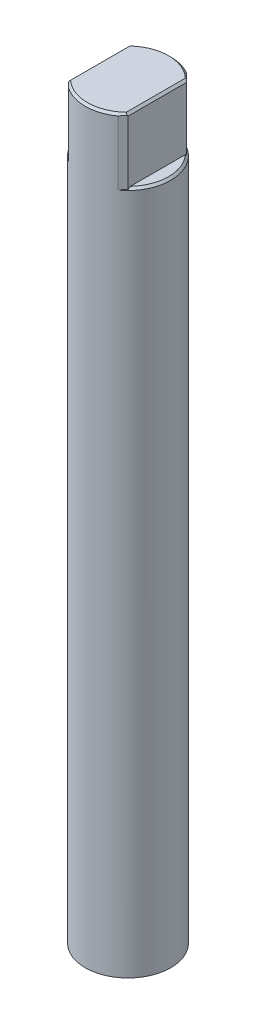
from build123d import *

# Parameters (mm, degrees)
SKETCH_1_R             = 10
EXTRUDE_1_DEPTH        = 175
SKETCH_2_W             = 7.534980856
SKETCH_2_H             = 25.851722938
CUT_EXTRUDE_1_DEPTH    = 15
HOLE_WIZARD_M8_1_D     = 6.8
HOLE_WIZARD_M8_1_DEPTH = 12
HOLE_WIZARD_M8_1_TIP   = 2.042926105
CHAMFER_1_SIZE         = 0.5
CHAMFER_4_SIZE         = 0.2
CHAMFER_5_SIZE         = 0.5
CHAMFER_2_SIZE         = 0.5


with BuildPart() as part:
    # 스케치1 → 보스-돌출1 (new body)
    with BuildSketch(Plane(origin=(0, 0, 0), x_dir=(1, 0, 0), z_dir=(0, 1, 0))):
        with Locations(Location((0, 0, 0), (0, 0, 270))):
            Circle(SKETCH_1_R)
    extrude(amount=EXTRUDE_1_DEPTH)

    # 스케치2 → 컷-돌출1 (cut)
    with BuildSketch(Plane(origin=(0, 175, 0), x_dir=(1, 0, 0), z_dir=(0, 1, 0))):
        with Locations((-10.767490428, 0.520710059)):
            Rectangle(SKETCH_2_W, SKETCH_2_H)
        with Locations((10.767490428, 0.520710059)):
            Rectangle(SKETCH_2_W, SKETCH_2_H)
    extrude(amount=-CUT_EXTRUDE_1_DEPTH, mode=Mode.SUBTRACT)

    # M8 나사 구멍1
    with Locations(Plane(origin=(0, 0, 0), x_dir=(-1, 0, 0), z_dir=(0, -1, 0))):
        with Locations((0, 0)):
            Hole(HOLE_WIZARD_M8_1_D / 2, depth=HOLE_WIZARD_M8_1_DEPTH)
            with Locations((0, 0, -(HOLE_WIZARD_M8_1_DEPTH + HOLE_WIZARD_M8_1_TIP / 2))):  # 118° drill point
                Cone(0, HOLE_WIZARD_M8_1_D / 2, HOLE_WIZARD_M8_1_TIP, mode=Mode.SUBTRACT)

    # 모따기1
    chamfer_1_edges = [part.edges().sort_by_distance(p)[0] for p in [
        (0, 175, -10),
        (3.780589618, 175, 9.257815193),
        (7, 175, 0),
        (-7, 175, 0),
    ]]
    chamfer(chamfer_1_edges, length=CHAMFER_1_SIZE)

    # 모따기4
    # the kernel refuses this chamfer: 14.141428429, 0.2 mm, written as the material it takes off along each edge
    with BuildSketch(Plane(origin=(-7, 179.872714198, 7.141428429), x_dir=(0.7673746516372044, 0, 0.6411989894133326), z_dir=(0, -1, 0))) as chamfer_4_piece_1:
        with BuildLine():
            Line((1.58509174, 0), (-CHAMFER_4_SIZE * 0.641198989413, -CHAMFER_4_SIZE * 0.767374651637))
            Line((-CHAMFER_4_SIZE * 0.641198989413, -CHAMFER_4_SIZE * 0.767374651637), (0, 0))
            ThreePointArc((0, 0), (1.074309981, 0.027485583), (1.58509174, 0))
        make_face()
    extrude(amount=19.872714198, mode=Mode.SUBTRACT)
    with BuildSketch(Plane(origin=(7, 179.872714198, 7.141428429), x_dir=(-0.7673746516372026, 0, 0.6411989894133348), z_dir=(0, -1, 0))) as chamfer_4_piece_2:
        with BuildLine():
            Line((1.58509174, 0), (-CHAMFER_4_SIZE * 0.641198989413, CHAMFER_4_SIZE * 0.767374651637))
            Line((-CHAMFER_4_SIZE * 0.641198989413, CHAMFER_4_SIZE * 0.767374651637), (0, 0))
            ThreePointArc((0, 0), (1.074309981, -0.027485583), (1.58509174, 0))
        make_face()
    extrude(amount=19.872714198, mode=Mode.SUBTRACT)

    # 모따기5
    # the kernel refuses this chamfer: 35.353571071, 0.5 mm, written as the material it takes off along each edge
    with BuildSketch(Plane(origin=(7, 184.418230147, -7.141428429), x_dir=(-0.7979254789483874, 0, -0.6027561115782952), z_dir=(0, -1, 0))) as chamfer_5_piece_1:
        with BuildLine():
            Line((2.561877444, 0), (-CHAMFER_5_SIZE * 0.602756111578, -CHAMFER_5_SIZE * 0.797925478948))
            Line((-CHAMFER_5_SIZE * 0.602756111578, -CHAMFER_5_SIZE * 0.797925478948), (0, 0))
            ThreePointArc((0, 0), (1.978478429, 0.058021773), (2.561877444, 0))
        make_face()
    extrude(amount=24.418230147, mode=Mode.SUBTRACT)
    with BuildSketch(Plane(origin=(-7, 184.418230147, -7.141428429), x_dir=(0.797925478948387, 0, -0.6027561115782961), z_dir=(0, -1, 0))) as chamfer_5_piece_2:
        with BuildLine():
            Line((2.561877444, 0), (-CHAMFER_5_SIZE * 0.602756111578, CHAMFER_5_SIZE * 0.797925478948))
            Line((-CHAMFER_5_SIZE * 0.602756111578, CHAMFER_5_SIZE * 0.797925478948), (0, 0))
            ThreePointArc((0, 0), (1.978478429, -0.058021773), (2.561877444, 0))
        make_face()
    extrude(amount=24.418230147, mode=Mode.SUBTRACT)

    # 모따기2
    # the kernel refuses this chamfer: 0.5 mm, written as the material it takes off along each edge
    with BuildSketch(Plane(origin=(0, 160, 0), x_dir=(-0.6999999999999962, 0, 0.7141428428542888), z_dir=(0.7141428428542888, 0, 0.6999999999999962))) as chamfer_2_piece_1_section:
        Polygon((10, CHAMFER_2_SIZE), (10 - CHAMFER_2_SIZE, 0), (10, 0), align=None)
    chamfer_2_piece_1 = revolve(axis=Axis((0, 160, 0), (0, -1, 0)), revolution_arc=113.236333046, mode=Mode.PRIVATE)
    chamfer_2_piece_1 = split(chamfer_2_piece_1, bisect_by=Plane(origin=(-7, 160, 0), z_dir=(-1, 0, 0)), keep=Keep.TOP, mode=Mode.PRIVATE)
    add(chamfer_2_piece_1, mode=Mode.SUBTRACT)
    with BuildSketch(Plane(origin=(0, 160, 0), x_dir=(-0.6999999999999962, 0, 0.7141428428542888), z_dir=(0.7141428428542888, 0, 0.6999999999999962))) as chamfer_2_piece_2_section:
        Polygon((10, CHAMFER_2_SIZE), (10 - CHAMFER_2_SIZE, 0), (10, 0), align=None)
    chamfer_2_piece_2 = revolve(axis=Axis((0, 160, 0), (0, -1, 0)), revolution_arc=113.236333046, mode=Mode.PRIVATE)
    chamfer_2_piece_2 = split(chamfer_2_piece_2, bisect_by=Plane(origin=(-6.970714214, 160, 6.970714214), z_dir=(-0.7071067811840911, 0, 0.707106781189004)), keep=Keep.TOP, mode=Mode.PRIVATE)
    add(chamfer_2_piece_2, mode=Mode.SUBTRACT)
    with BuildSketch(Plane(origin=(0, 160, 0), x_dir=(-0.6999999999999962, 0, 0.7141428428542888), z_dir=(0.7141428428542888, 0, 0.6999999999999962))) as chamfer_2_piece_3_section:
        Polygon((10, CHAMFER_2_SIZE), (10 - CHAMFER_2_SIZE, 0), (10, 0), align=None)
    chamfer_2_piece_3 = revolve(axis=Axis((0, 160, 0), (0, -1, 0)), revolution_arc=113.236333046, mode=Mode.PRIVATE)
    chamfer_2_piece_3 = split(chamfer_2_piece_3, bisect_by=Plane(origin=(-6.820714214, 160, -6.820714214), z_dir=(-0.707106781186502, 0, -0.707106781186593)), keep=Keep.TOP, mode=Mode.PRIVATE)
    add(chamfer_2_piece_3, mode=Mode.SUBTRACT)
    with BuildSketch(Plane(origin=(0, 160, 0), x_dir=(0.38004811354694096, 0, -0.9249667190712385), z_dir=(-0.9249667190712385, 0, -0.38004811354694096))) as chamfer_2_piece_4_section:
        Polygon((10, CHAMFER_2_SIZE), (10 - CHAMFER_2_SIZE, 0), (10, 0), align=None)
    chamfer_2_piece_4 = revolve(axis=Axis((0, 160, 0), (0, -1, 0)), revolution_arc=113.236333046, mode=Mode.PRIVATE)
    chamfer_2_piece_4 = split(chamfer_2_piece_4, bisect_by=Plane(origin=(7, 160, 0), z_dir=(1, 0, 0)), keep=Keep.TOP, mode=Mode.PRIVATE)
    add(chamfer_2_piece_4, mode=Mode.SUBTRACT)
    with BuildSketch(Plane(origin=(0, 160, 0), x_dir=(0.38004811354694096, 0, -0.9249667190712385), z_dir=(-0.9249667190712385, 0, -0.38004811354694096))) as chamfer_2_piece_5_section:
        Polygon((10, CHAMFER_2_SIZE), (10 - CHAMFER_2_SIZE, 0), (10, 0), align=None)
    chamfer_2_piece_5 = revolve(axis=Axis((0, 160, 0), (0, -1, 0)), revolution_arc=113.236333046, mode=Mode.PRIVATE)
    chamfer_2_piece_5 = split(chamfer_2_piece_5, bisect_by=Plane(origin=(6.820714214, 160, -6.820714214), z_dir=(0.707106781186502, 0, -0.707106781186593)), keep=Keep.TOP, mode=Mode.PRIVATE)
    add(chamfer_2_piece_5, mode=Mode.SUBTRACT)
    with BuildSketch(Plane(origin=(0, 160, 0), x_dir=(0.38004811354694096, 0, -0.9249667190712385), z_dir=(-0.9249667190712385, 0, -0.38004811354694096))) as chamfer_2_piece_6_section:
        Polygon((10, CHAMFER_2_SIZE), (10 - CHAMFER_2_SIZE, 0), (10, 0), align=None)
    chamfer_2_piece_6 = revolve(axis=Axis((0, 160, 0), (0, -1, 0)), revolution_arc=113.236333046, mode=Mode.PRIVATE)
    chamfer_2_piece_6 = split(chamfer_2_piece_6, bisect_by=Plane(origin=(6.970714214, 160, 6.970714214), z_dir=(0.7071067811840911, 0, 0.707106781189004)), keep=Keep.TOP, mode=Mode.PRIVATE)
    add(chamfer_2_piece_6, mode=Mode.SUBTRACT)
    with BuildSketch(Plane(origin=(0, 160, 0), x_dir=(0.6999999999991152, 0, 0.7141428428551523), z_dir=(0.7141428428551523, 0, -0.6999999999991152))) as chamfer_2_piece_7_section:
        Polygon((10, CHAMFER_2_SIZE), (10 - CHAMFER_2_SIZE, 0), (10, 0), align=None)
    chamfer_2_piece_7 = revolve(axis=Axis((0, 160, 0), (0, -1, 0)), revolution_arc=16.458800605, mode=Mode.PRIVATE)
    chamfer_2_piece_7 = split(chamfer_2_piece_7, bisect_by=Plane(origin=(6.970714214, 160, 6.970714214), z_dir=(0.7071067811840911, 0, 0.707106781189004)), keep=Keep.TOP, mode=Mode.PRIVATE)
    add(chamfer_2_piece_7, mode=Mode.SUBTRACT)
    with BuildSketch(Plane(origin=(0, 160, 0), x_dir=(-0.6999999999991152, 0, 0.7141428428551523), z_dir=(-0.7141428428551523, 0, -0.6999999999991152))) as chamfer_2_piece_8_section:
        Polygon((10, -CHAMFER_2_SIZE), (10 - CHAMFER_2_SIZE, 0), (10, 0), align=None)
    chamfer_2_piece_8 = revolve(axis=Axis((0, 160, 0), (0, 1, 0)), revolution_arc=16.458800605, mode=Mode.PRIVATE)
    chamfer_2_piece_8 = split(chamfer_2_piece_8, bisect_by=Plane(origin=(-6.970714214, 160, 6.970714214), z_dir=(-0.7071067811840911, 0, 0.707106781189004)), keep=Keep.TOP, mode=Mode.PRIVATE)
    add(chamfer_2_piece_8, mode=Mode.SUBTRACT)


solid = part.part
